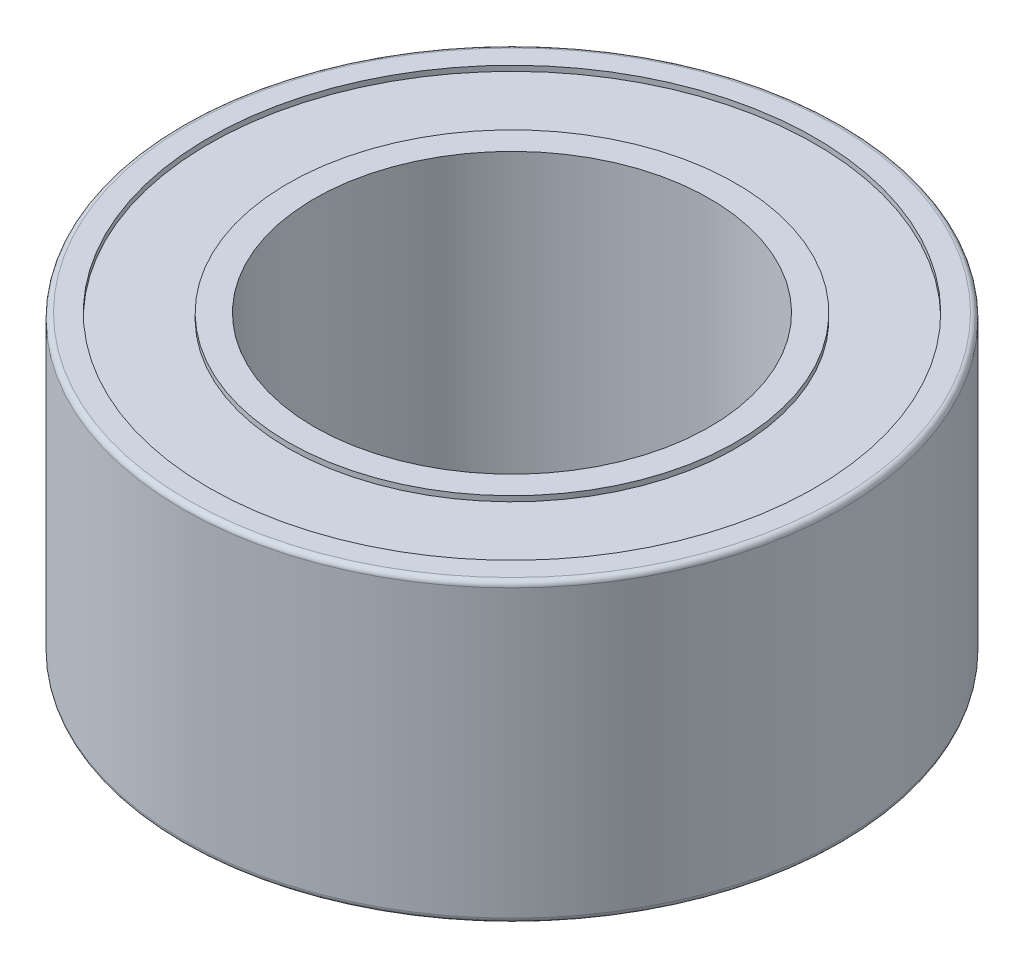
from build123d import *

# Parameters (mm, degrees)
SKETCH1_R           = 7.9375
SKETCH1_R_2         = 4.7625
BOSS_EXTRUDE1_DEPTH = 7.14375
SKETCH2_R           = 7.3025
SKETCH2_R_2         = 5.3975
CUT_EXTRUDE1_DEPTH  = 0.127
CUT_EXTRUDE3_START  = -0.127
SKETCH3_R           = 7.3025
SKETCH3_R_2         = 5.3975
CUT_EXTRUDE3_DEPTH  = 0.127
FILLET1_R           = 0.127


with BuildPart() as part:
    # Sketch1 → Boss-Extrude1 (new body)
    with BuildSketch(Plane(origin=(0, 0, 0), x_dir=(1, 0, 0), z_dir=(0, 1, 0))):
        Circle(SKETCH1_R)
        Circle(SKETCH1_R_2, mode=Mode.SUBTRACT)
    extrude(amount=BOSS_EXTRUDE1_DEPTH)

    # Sketch2 → Cut-Extrude1 (cut)
    with BuildSketch(Plane(origin=(0, 7.14375, 0), x_dir=(1, 0, 0), z_dir=(0, 1, 0))):
        Circle(SKETCH2_R)
        Circle(SKETCH2_R_2, mode=Mode.SUBTRACT)
    extrude(amount=-CUT_EXTRUDE1_DEPTH, mode=Mode.SUBTRACT)

    # Sketch3 → Cut-Extrude3 (cut)
    with BuildSketch(Plane.XZ.offset(CUT_EXTRUDE3_START)):
        Circle(SKETCH3_R)
        Circle(SKETCH3_R_2, mode=Mode.SUBTRACT)
    extrude(amount=CUT_EXTRUDE3_DEPTH, mode=Mode.SUBTRACT)

    # Fillet1
    fillet1_edges = [part.edges().sort_by_distance(p)[0] for p in [
        (-7.9375, 0, 0),
        (-7.9375, 7.14375, 0),
    ]]
    fillet(fillet1_edges, radius=FILLET1_R)


solid = part.part
